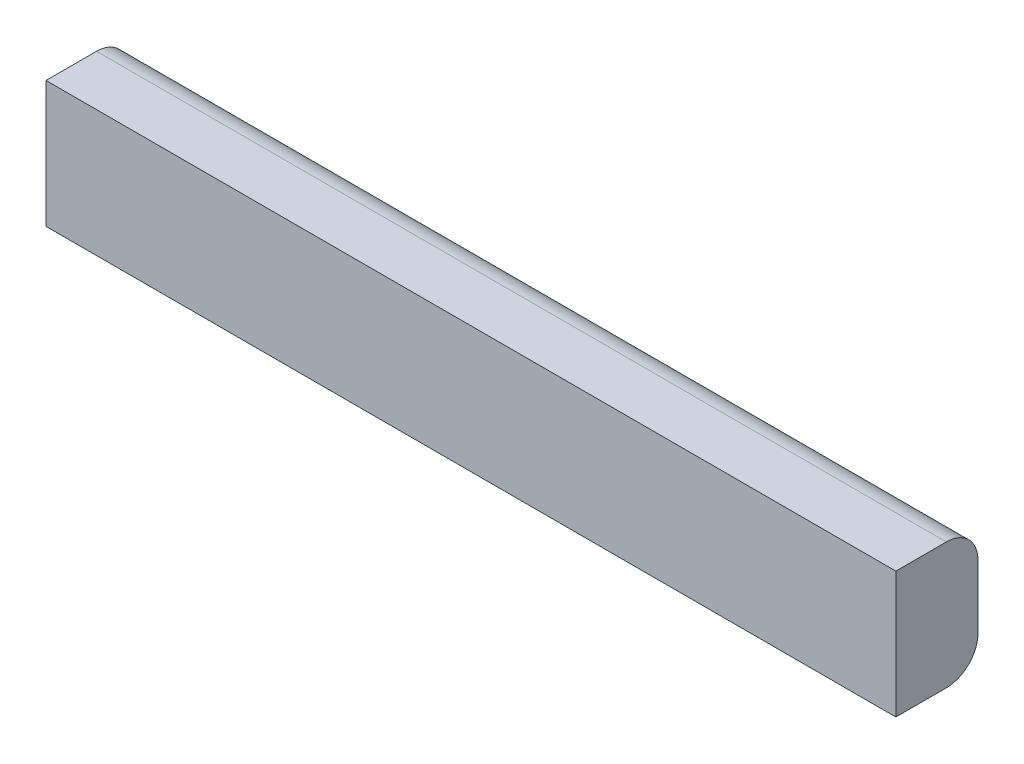
from build123d import *

# Parameters (mm, degrees)
BOSS_EXTRUDE1_DEPTH = 426.974


with BuildPart() as part:
    # Sketch1 → Boss-Extrude1 (new, symmetric)
    with BuildSketch(Plane(origin=(0, 0, 0), x_dir=(0, 0, -1), z_dir=(1, 0, 0))):
        with BuildLine():
            Line((49.373646209, 66.02166065), (-1.426353791, 66.02166065))
            Line((-1.426353791, 66.02166065), (-1.426353791, -60.97833935))
            Line((-1.426353791, -60.97833935), (49.373646209, -60.97833935))
            ThreePointArc((49.373646209, -60.97833935), (71.824286512, -51.678979653), (81.123646209, -29.22833935))
            Line((81.123646209, -29.22833935), (81.123646209, 34.27166065))
            ThreePointArc((81.123646209, 34.27166065), (71.824286512, 56.722300952), (49.373646209, 66.02166065))
        make_face()
    extrude(amount=BOSS_EXTRUDE1_DEPTH, both=True)


solid = part.part
